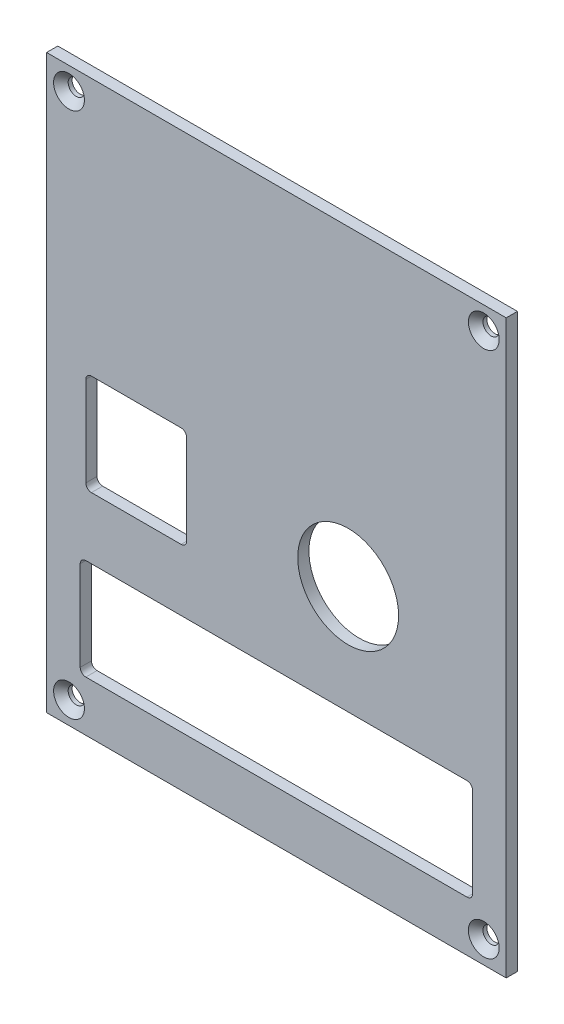
from build123d import *

# Parameters (mm, degrees)
SKETCH1_W                                    = 82
SKETCH1_H                                    = 102
BOSS_EXTRUDE1_DEPTH                          = 2
SKETCH2_R                                    = 9
CUT_EXTRUDE2_DEPTH                           = 2
CSK_FOR_M2_5_COUNTERSUNK_FLAT_HEAD_S_2_COUNT = 2
CSK_FOR_M2_5_COUNTERSUNK_FLAT_HEAD_S_2_PITCH = 94
CSK_FOR_M2_5_COUNTERSUNK_FLAT_HEAD_S_3_COUNT = 2
CSK_FOR_M2_5_COUNTERSUNK_FLAT_HEAD_S_3_PITCH = 119.63277143
CSK_FOR_M2_5_COUNTERSUNK_FLAT_HEAD_S_4_COUNT = 2
CSK_FOR_M2_5_COUNTERSUNK_FLAT_HEAD_S_4_PITCH = 74


with BuildPart() as part:
    # Sketch1 → Boss-Extrude1 (new body)
    with BuildSketch(Plane.XY):
        with Locations((-8.498222994, 4.726902457)):
            Rectangle(SKETCH1_W, SKETCH1_H)
    extrude(amount=BOSS_EXTRUDE1_DEPTH)

    # Sketch2 → Cut-Extrude2 (cut)
    with BuildSketch(Plane.XY.offset(2)):
        with Locations((4.301781638, 0.112195324)):
            Circle(SKETCH2_R)
        with BuildLine():
            Line((-42.498222994, -19.273097543), (25.501777006, -19.273097543))
            ThreePointArc((25.501777006, -19.273097543), (26.208883787, -19.565990762), (26.501777006, -20.273097543))
            Line((26.501777006, -20.273097543), (26.501777006, -36.273097543))
            ThreePointArc((26.501777006, -36.273097543), (26.208883787, -36.980204324), (25.501777006, -37.273097543))
            Line((25.501777006, -37.273097543), (-42.498222994, -37.273097543))
            ThreePointArc((-42.498222994, -37.273097543), (-43.205329775, -36.980204324), (-43.498222994, -36.273097543))
            Line((-43.498222994, -36.273097543), (-43.498222994, -20.273097543))
            ThreePointArc((-43.498222994, -20.273097543), (-43.205329775, -19.565990762), (-42.498222994, -19.273097543))
        make_face()
        with BuildLine():
            Line((-41.498222994, 9.726902457), (-25.498222994, 9.726902457))
            ThreePointArc((-25.498222994, 9.726902457), (-24.791116213, 9.434009238), (-24.498222994, 8.726902457))
            Line((-24.498222994, 8.726902457), (-24.498222994, -7.273097543))
            ThreePointArc((-24.498222994, -7.273097543), (-24.791116213, -7.980204324), (-25.498222994, -8.273097543))
            Line((-25.498222994, -8.273097543), (-41.498222994, -8.273097543))
            ThreePointArc((-41.498222994, -8.273097543), (-42.205329775, -7.980204324), (-42.498222994, -7.273097543))
            Line((-42.498222994, -7.273097543), (-42.498222994, 8.726902457))
            ThreePointArc((-42.498222994, 8.726902457), (-42.205329775, 9.434009238), (-41.498222994, 9.726902457))
        make_face()
    extrude(amount=-CUT_EXTRUDE2_DEPTH, mode=Mode.SUBTRACT)

    # Sketch18 → CSK for M2.5 Countersunk Flat Head Screw2 (revolve, cut)
    with BuildSketch(Plane(origin=(-45.498222994, 51.726902457, 2), x_dir=(0, -1, 0), z_dir=(1, 0, 0))):
        Polygon((0, 0), (0, 2), (1.45, 2), (1.45, 1.3), (2.75, 0), align=None)
    csk_for_m2_5_countersunk_flat_head_screw = revolve(axis=Axis((-45.498222994, 51.726902457, 8.35), (0, 0, -1)), mode=Mode.SUBTRACT)

    # CSK for M2.5 Countersunk Flat Head S 2: CSK for M2.5 Countersunk Flat Head Screw2 ×2
    with Locations(*[(0, -i * CSK_FOR_M2_5_COUNTERSUNK_FLAT_HEAD_S_2_PITCH, 0) for i in range(1, CSK_FOR_M2_5_COUNTERSUNK_FLAT_HEAD_S_2_COUNT)]):
        add(csk_for_m2_5_countersunk_flat_head_screw, mode=Mode.SUBTRACT)

    # CSK for M2.5 Countersunk Flat Head S 3: CSK for M2.5 Countersunk Flat Head Screw2 ×2
    with Locations(*[Vector(0.6185596063312608, -0.7857378783126824, 0) * (i * CSK_FOR_M2_5_COUNTERSUNK_FLAT_HEAD_S_3_PITCH) for i in range(1, CSK_FOR_M2_5_COUNTERSUNK_FLAT_HEAD_S_3_COUNT)]):
        add(csk_for_m2_5_countersunk_flat_head_screw, mode=Mode.SUBTRACT)

    # CSK for M2.5 Countersunk Flat Head S 4: CSK for M2.5 Countersunk Flat Head Screw2 ×2
    with Locations(*[(i * CSK_FOR_M2_5_COUNTERSUNK_FLAT_HEAD_S_4_PITCH, 0, 0) for i in range(1, CSK_FOR_M2_5_COUNTERSUNK_FLAT_HEAD_S_4_COUNT)]):
        add(csk_for_m2_5_countersunk_flat_head_screw, mode=Mode.SUBTRACT)


solid = part.part
